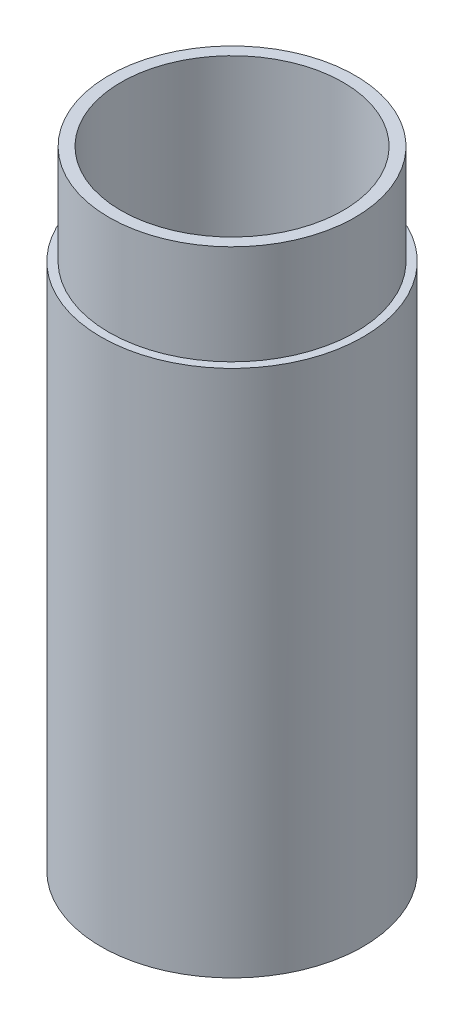
from build123d import *

# Parameters (mm, degrees)
SKETCH1_R           = 13.15
SKETCH1_R_2         = 11.15
BOSS_EXTRUDE1_DEPTH = 60
BOSS_EXTRUDE2_START = 3
SKETCH2_R           = 13.15
SKETCH2_R_2         = 9.15
BOSS_EXTRUDE2_DEPTH = 3
CUT_EXTRUDE1_START  = -10
SKETCH3_R           = 13.15
SKETCH3_R_2         = 12.35
CUT_EXTRUDE1_DEPTH  = 10


with BuildPart() as part:
    # Sketch1 → Boss-Extrude1 (new body)
    with BuildSketch(Plane(origin=(0, 0, 0), x_dir=(1, 0, 0), z_dir=(0, 1, 0))):
        Circle(SKETCH1_R)
        Circle(SKETCH1_R_2, mode=Mode.SUBTRACT)
    extrude(amount=BOSS_EXTRUDE1_DEPTH)

    # Sketch2 → Boss-Extrude2 (add)
    with BuildSketch(Plane.XZ.offset(BOSS_EXTRUDE2_START)):
        Circle(SKETCH2_R)
        Circle(SKETCH2_R_2, mode=Mode.SUBTRACT)
    extrude(amount=-BOSS_EXTRUDE2_DEPTH)

    # Sketch3 → Cut-Extrude1 (cut)
    with BuildSketch(Plane(origin=(0, 60, 0), x_dir=(1, 0, 0), z_dir=(0, 1, 0)).offset(CUT_EXTRUDE1_START)):
        Circle(SKETCH3_R)
        Circle(SKETCH3_R_2, mode=Mode.SUBTRACT)
    extrude(amount=CUT_EXTRUDE1_DEPTH, mode=Mode.SUBTRACT)


solid = part.part
